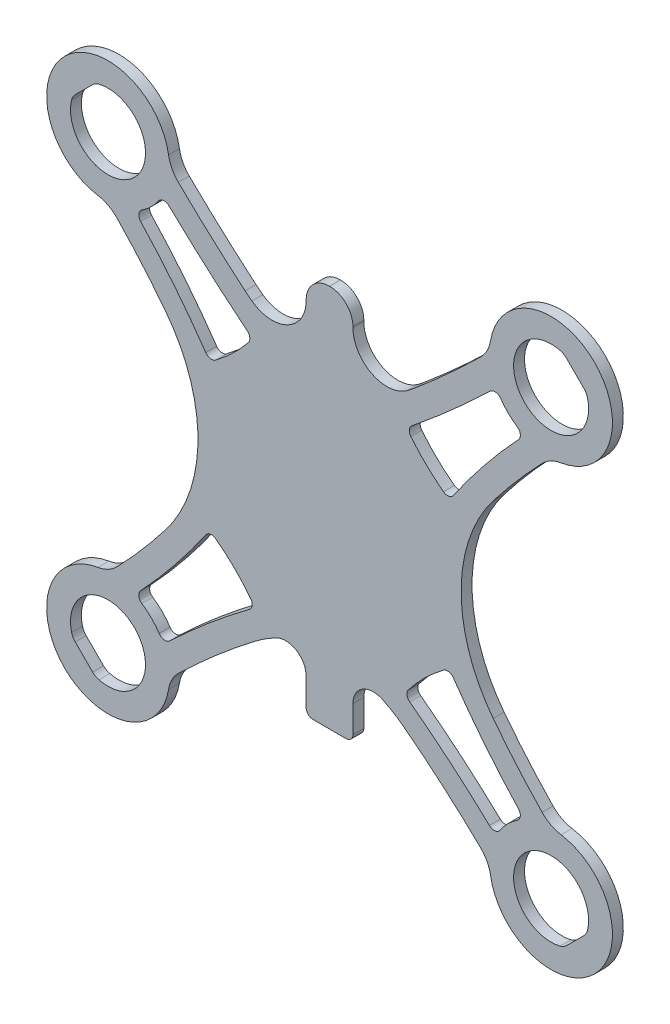
from build123d import *

# Parameters (mm, degrees)
BOSS_EXTRUDE1_DEPTH = 1.6
CUT_EXTRUDE3_DEPTH  = 59.711668346


with BuildPart() as part:
    # Sketch1 → Boss-Extrude1 (new body)
    with BuildSketch(Plane.XY):
        with BuildLine():
            Line((-3.429, -22.169410702), (-3.429, -26.178))
            ThreePointArc((-3.429, -26.178), (-3.136106781, -26.885106781), (-2.429, -27.178))
            Line((-2.429, -27.178), (2.429, -27.178))
            ThreePointArc((2.429, -27.178), (3.136106781, -26.885106781), (3.429, -26.178))
            Line((3.429, -26.178), (3.429, -22.22966812))
            ThreePointArc((3.429, -22.22966812), (4.826254657, -19.693685595), (7.716471578, -19.519978666))
            ThreePointArc((7.716471578, -19.519978666), (9.379032197, -20.419956769), (10.937907763, -21.489524611))
            ThreePointArc((10.937907763, -21.489524611), (16.695290309, -26.175210804), (22.169453406, -31.188856909))
            ThreePointArc((22.169453406, -31.188856909), (23.117301861, -32.459556006), (23.619723106, -33.963107063))
            ThreePointArc((23.619723106, -33.963107063), (38.862466656, -38.865455055), (33.967276916, -23.620411133))
            ThreePointArc((33.967276916, -23.620411133), (32.455427267, -23.112806715), (31.180313141, -22.154978144))
            ThreePointArc((31.180313141, -22.154978144), (27.47385025, -18.084321842), (23.999156064, -13.81412159))
            ThreePointArc((23.999156064, -13.81412159), (20.509860624, -7.295108734), (19.304, 0))
            ThreePointArc((19.304, 0), (20.509860624, 7.295108734), (23.999156064, 13.81412159))
            ThreePointArc((23.999156064, 13.81412159), (27.47385025, 18.084321842), (31.180313141, 22.154978144))
            ThreePointArc((31.180313141, 22.154978144), (32.455427267, 23.112806715), (33.967276916, 23.620411133))
            ThreePointArc((33.967276916, 23.620411133), (38.861014354, 38.866906343), (23.61905648, 33.959055239))
            ThreePointArc((23.61905648, 33.959055239), (23.121622823, 32.463531472), (22.183380489, 31.19714571))
            ThreePointArc((22.183380489, 31.19714571), (17.368920037, 26.656724902), (12.387395689, 22.300250899))
            ThreePointArc((12.387395689, 22.300250899), (11.895164251, 21.899521015), (11.389978134, 21.515251299))
            ThreePointArc((11.389978134, 21.515251299), (6.171223513, 21.083006766), (3.429, 25.544222445))
            Line((3.429, 25.544222445), (3.429, 25.6764))
            ThreePointArc((3.429, 25.6764), (2.43210864, 28.08310864), (0.0254, 29.08))
            Line((0.0254, 29.08), (-0.0254, 29.08))
            ThreePointArc((-0.0254, 29.08), (-2.43210864, 28.08310864), (-3.429, 25.6764))
            Line((-3.429, 25.6764), (-3.429, 25.544222445))
            ThreePointArc((-3.429, 25.544222445), (-6.171223513, 21.083006766), (-11.389978134, 21.515251299))
            ThreePointArc((-11.389978134, 21.515251299), (-11.895164251, 21.899521015), (-12.387395689, 22.300250899))
            ThreePointArc((-12.387395689, 22.300250899), (-17.368920037, 26.656724902), (-22.183380489, 31.19714571))
            ThreePointArc((-22.183380489, 31.19714571), (-23.121622823, 32.463531472), (-23.61905648, 33.959055239))
            ThreePointArc((-23.61905648, 33.959055239), (-38.861014354, 38.866906343), (-33.967276916, 23.620411133))
            ThreePointArc((-33.967276916, 23.620411133), (-32.455427267, 23.112806715), (-31.180313141, 22.154978144))
            ThreePointArc((-31.180313141, 22.154978144), (-27.47385025, 18.084321842), (-23.999156064, 13.81412159))
            ThreePointArc((-23.999156064, 13.81412159), (-20.509860624, 7.295108734), (-19.304, 0))
            ThreePointArc((-19.304, 0), (-20.509860624, -7.295108734), (-23.999156064, -13.81412159))
            ThreePointArc((-23.999156064, -13.81412159), (-27.47385025, -18.084321842), (-31.180313141, -22.154978144))
            ThreePointArc((-31.180313141, -22.154978144), (-32.455427267, -23.112806715), (-33.967276916, -23.620411133))
            ThreePointArc((-33.967276916, -23.620411133), (-38.862466656, -38.865455055), (-23.619723106, -33.963107063))
            ThreePointArc((-23.619723106, -33.963107063), (-23.117301861, -32.459556006), (-22.169453406, -31.188856909))
            ThreePointArc((-22.169453406, -31.188856909), (-16.695290309, -26.175210804), (-10.937907763, -21.489524611))
            ThreePointArc((-10.937907763, -21.489524611), (-9.414925724, -20.426362093), (-7.803463878, -19.502793172))
            ThreePointArc((-7.803463878, -19.502793172), (-4.867492977, -19.607829976), (-3.429, -22.169410702))
        make_face()
    extrude(amount=BOSS_EXTRUDE1_DEPTH)

    # Sketch1<5> → Cut-Extrude3 (cut, through all)
    with BuildSketch(Plane.XY):
        with BuildLine():
            Line((-37.310288784, -34.760779028), (-34.760779028, -37.310288784))
            ThreePointArc((-34.760779028, -37.310288784), (-34.33137128, -37.636809983), (-33.83031716, -37.836689635))
            ThreePointArc((-33.83031716, -37.836689635), (-28.610912703, -28.610912703), (-37.836689635, -33.83031716))
            ThreePointArc((-37.836689635, -33.83031716), (-37.636809983, -34.33137128), (-37.310288784, -34.760779028))
        make_face()
        with BuildLine():
            ThreePointArc((33.83031716, -37.836689635), (34.33137128, -37.636809983), (34.760779028, -37.310288784))
            Line((34.760779028, -37.310288784), (37.310288784, -34.760779028))
            ThreePointArc((37.310288784, -34.760779028), (37.636809983, -34.33137128), (37.836689635, -33.83031716))
            ThreePointArc((37.836689635, -33.83031716), (28.610912703, -28.610912703), (33.83031716, -37.836689635))
        make_face()
        with BuildLine():
            ThreePointArc((-33.83031716, 37.836689635), (-34.33137128, 37.636809983), (-34.760779028, 37.310288784))
            Line((-34.760779028, 37.310288784), (-37.310288784, 34.760779028))
            ThreePointArc((-37.310288784, 34.760779028), (-37.636809983, 34.33137128), (-37.836689635, 33.83031716))
            ThreePointArc((-37.836689635, 33.83031716), (-28.610912703, 28.610912703), (-33.83031716, 37.836689635))
        make_face()
        with BuildLine():
            Line((37.310288784, 34.760779028), (34.760779028, 37.310288784))
            ThreePointArc((34.760779028, 37.310288784), (34.33137128, 37.636809983), (33.83031716, 37.836689635))
            ThreePointArc((33.83031716, 37.836689635), (28.610912703, 28.610912703), (37.836689635, 33.83031716))
            ThreePointArc((37.836689635, 33.83031716), (37.636809983, 34.33137128), (37.310288784, 34.760779028))
        make_face()
        with BuildLine():
            ThreePointArc((-24.998680714, -27.527052285), (-24.266539251, -27.975169466), (-23.452541635, -27.702684585))
            ThreePointArc((-23.452541635, -27.702684585), (-17.751335536, -22.602028101), (-11.761197607, -17.84401432))
            ThreePointArc((-11.761197607, -17.84401432), (-11.363038546, -17.168840008), (-11.563944828, -16.411193879))
            ThreePointArc((-11.563944828, -16.411193879), (-13.962913518, -13.697220596), (-16.710750131, -11.337115576))
            ThreePointArc((-16.710750131, -11.337115576), (-17.483496193, -11.148963344), (-18.155018506, -11.575103607))
            ThreePointArc((-18.155018506, -11.575103607), (-22.713350188, -17.692311571), (-27.713994469, -23.453576864))
            ThreePointArc((-27.713994469, -23.453576864), (-27.981074308, -24.266291585), (-27.532770213, -24.994893189))
            ThreePointArc((-27.532770213, -24.994893189), (-26.138464304, -26.133614559), (-24.998680714, -27.527052285))
        make_face()
        with BuildLine():
            ThreePointArc((18.155018506, -11.575103607), (17.483496193, -11.148963344), (16.710750131, -11.337115576))
            ThreePointArc((16.710750131, -11.337115576), (13.962913518, -13.697220596), (11.563944828, -16.411193879))
            ThreePointArc((11.563944828, -16.411193879), (11.363038546, -17.168840008), (11.761197607, -17.84401432))
            ThreePointArc((11.761197607, -17.84401432), (17.751335536, -22.602028101), (23.452541635, -27.702684585))
            ThreePointArc((23.452541635, -27.702684585), (24.266539251, -27.975169466), (24.998680714, -27.527052285))
            ThreePointArc((24.998680714, -27.527052285), (26.138464304, -26.133614559), (27.532770213, -24.994893189))
            ThreePointArc((27.532770213, -24.994893189), (27.981074308, -24.266291585), (27.713994469, -23.453576864))
            ThreePointArc((27.713994469, -23.453576864), (22.713350188, -17.692311571), (18.155018506, -11.575103607))
        make_face()
        with BuildLine():
            ThreePointArc((-12.074975691, 17.380952209), (-17.927124595, 22.331716527), (-23.562984675, 27.527368101))
            ThreePointArc((-23.562984675, 27.527368101), (-24.368188535, 27.806201558), (-25.102498374, 27.37389332))
            ThreePointArc((-25.102498374, 27.37389332), (-26.204243006, 26.068558181), (-27.532770213, 24.994893189))
            ThreePointArc((-27.532770213, 24.994893189), (-27.981074308, 24.266291585), (-27.713994469, 23.453576864))
            ThreePointArc((-27.713994469, 23.453576864), (-22.713350188, 17.692311571), (-18.155018506, 11.575103607))
            ThreePointArc((-18.155018506, 11.575103607), (-17.483496193, 11.148963344), (-16.710750131, 11.337115576))
            ThreePointArc((-16.710750131, 11.337115576), (-14.170722957, 13.494587833), (-11.922695283, 15.954830943))
            ThreePointArc((-11.922695283, 15.954830943), (-11.704234617, 16.699348887), (-12.074975691, 17.380952209))
        make_face()
        with BuildLine():
            ThreePointArc((25.102498374, 27.37389332), (24.368188535, 27.806201558), (23.562984675, 27.527368101))
            ThreePointArc((23.562984675, 27.527368101), (17.927124595, 22.331716527), (12.074975691, 17.380952209))
            ThreePointArc((12.074975691, 17.380952209), (11.704234617, 16.699348887), (11.922695283, 15.954830943))
            ThreePointArc((11.922695283, 15.954830943), (14.170722957, 13.494587833), (16.710750131, 11.337115576))
            ThreePointArc((16.710750131, 11.337115576), (17.483496193, 11.148963344), (18.155018506, 11.575103607))
            ThreePointArc((18.155018506, 11.575103607), (22.713350188, 17.692311571), (27.713994469, 23.453576864))
            ThreePointArc((27.713994469, 23.453576864), (27.981074308, 24.266291585), (27.532770213, 24.994893189))
            ThreePointArc((27.532770213, 24.994893189), (26.204243006, 26.068558181), (25.102498374, 27.37389332))
        make_face()
    extrude(amount=CUT_EXTRUDE3_DEPTH, mode=Mode.SUBTRACT)


solid = part.part
